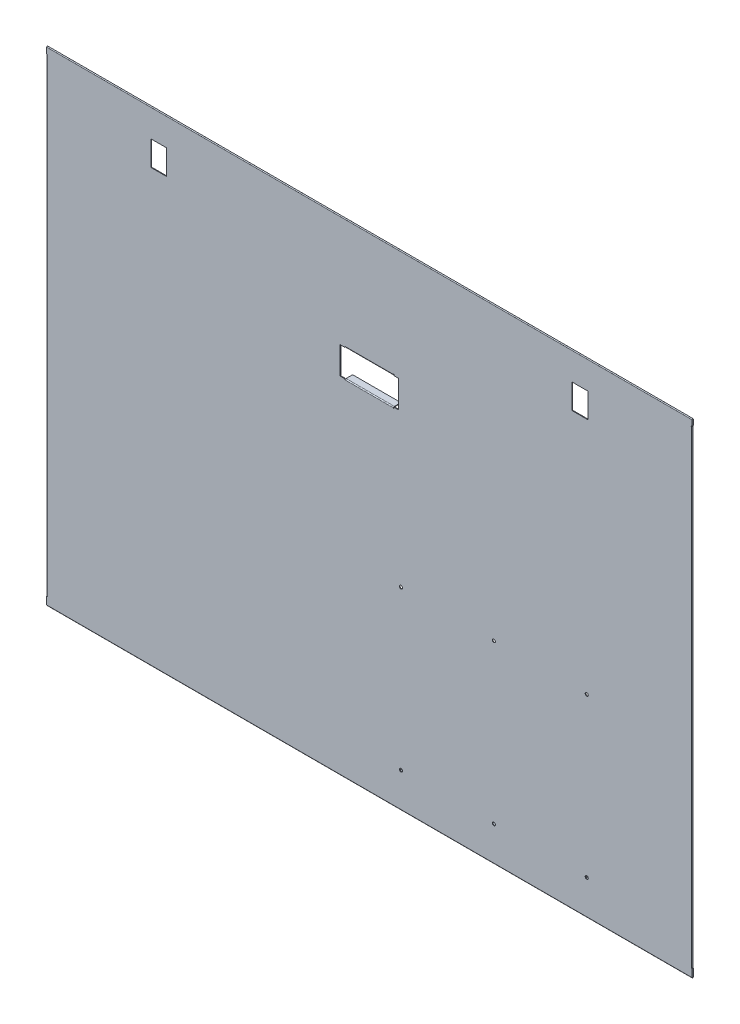
from build123d import *

# Parameters (mm, degrees)
SKETCH_1_W                          = 1042
SKETCH_1_H                          = 782
SM_BASE_FLANGE_1_DEPTH              = 1
SKETCH_3_W                          = 25.5
SKETCH_3_H                          = 40
SKETCH_3_W_2                        = 94
SKETCH_3_H_2                        = 44
CUT_EXTRUDE_1_DEPTH                 = 652.40079828
SM_EDGE_FLANGE_1_STRIP_W            = 5
SM_EDGE_FLANGE_1_STRIP_H            = 1
SM_EDGE_FLANGE_1_STRIP_CUT_DEPTH    = 78
SM_EDGE_FLANGE_1_RELIEF_W           = 5.5
SM_EDGE_FLANGE_1_RELIEF_H           = 0.5
SM_EDGE_FLANGE_1_RELIEF_CUT_DEPTH   = 1
SM_EDGE_FLANGE_1_DEPTH              = 78
SM_EDGE_FLANGE_2_STRIP_W            = 5
SM_EDGE_FLANGE_2_STRIP_H            = 1
SM_EDGE_FLANGE_2_STRIP_CUT_DEPTH    = 78
SM_EDGE_FLANGE_2_RELIEF_W           = 5.5
SM_EDGE_FLANGE_2_RELIEF_H           = 0.5
SM_EDGE_FLANGE_2_RELIEF_CUT_DEPTH   = 1
SM_EDGE_FLANGE_2_DEPTH              = 78
OTHER_START                         = -521
OTHER_1_DEPTH                       = 1042
OTHER_1_2_DEPTH                     = 1042
OTHER_2_DEPTH                       = 1042
OTHER_2_2_DEPTH                     = 1042
SKETCH_12_W                         = 157.957102661
SKETCH_12_H                         = 759
SKETCH_12_W_2                       = 80.930745007
CUT_EXTRUDE_2_DEPTH                 = 1
OTHER_START_2                       = -377.5
OTHER_5_DEPTH                       = 758
OTHER_5_2_DEPTH                     = 0.5
OTHER_START_3                       = 380
OTHER_5_3_DEPTH                     = 0.5
OTHER_START_4                       = -377
OTHER_5_4_DEPTH                     = 757
OTHER_6_DEPTH                       = 758
OTHER_6_2_DEPTH                     = 0.5
OTHER_6_3_DEPTH                     = 0.5
OTHER_6_4_DEPTH                     = 757
SM_EDGE_FLANGE_3_STRIP_W            = 5
SM_EDGE_FLANGE_3_STRIP_H            = 1
SM_EDGE_FLANGE_3_STRIP_CUT_DEPTH    = 902
SM_EDGE_FLANGE_3_RELIEF_W           = 5.5
SM_EDGE_FLANGE_3_RELIEF_H           = 0.5
SM_EDGE_FLANGE_3_RELIEF_CUT_DEPTH   = 1
SM_EDGE_FLANGE_3_DEPTH              = 902
SM_EDGE_FLANGE_3_FLAT_DEPTH         = 1
SM_EDGE_FLANGE_4_STRIP_W            = 5
SM_EDGE_FLANGE_4_STRIP_H            = 1
SM_EDGE_FLANGE_4_STRIP_CUT_DEPTH    = 902
SM_EDGE_FLANGE_4_RELIEF_W           = 5.5
SM_EDGE_FLANGE_4_RELIEF_H           = 0.5
SM_EDGE_FLANGE_4_RELIEF_CUT_DEPTH   = 1
SM_EDGE_FLANGE_4_DEPTH              = 902
SM_EDGE_FLANGE_4_FLAT_DEPTH         = 1
SM_EDGE_FLANGE_5_STRIP_W            = 5
SM_EDGE_FLANGE_5_STRIP_H            = 1
SM_EDGE_FLANGE_5_STRIP_CUT_DEPTH    = 641
SM_EDGE_FLANGE_5_RELIEF_W           = 5.5
SM_EDGE_FLANGE_5_RELIEF_H           = 0.5
SM_EDGE_FLANGE_5_RELIEF_CUT_DEPTH   = 1
SM_EDGE_FLANGE_5_DEPTH              = 641
SM_EDGE_FLANGE_6_STRIP_W            = 5
SM_EDGE_FLANGE_6_STRIP_H            = 1
SM_EDGE_FLANGE_6_STRIP_CUT_DEPTH    = 641
SM_EDGE_FLANGE_6_RELIEF_W           = 5.5
SM_EDGE_FLANGE_6_RELIEF_H           = 0.5
SM_EDGE_FLANGE_6_RELIEF_CUT_DEPTH   = 1
SM_EDGE_FLANGE_6_DEPTH              = 641
SKETCH_64_R                         = 2.5
CUT_EXTRUDE_4_DEPTH                 = 653.291966837
SM_EDGE_FLANGE_7_STRIP_W            = 5
SM_EDGE_FLANGE_7_STRIP_H            = 1
SM_EDGE_FLANGE_7_STRIP_CUT_DEPTH    = 215
SM_EDGE_FLANGE_7_STRIP_2_W          = 5
SM_EDGE_FLANGE_7_STRIP_2_H          = 1
SM_EDGE_FLANGE_7_STRIP_CUT_2_DEPTH  = 287
SM_EDGE_FLANGE_7_RELIEF_W           = 5.5
SM_EDGE_FLANGE_7_RELIEF_H           = 0.5
SM_EDGE_FLANGE_7_RELIEF_CUT_DEPTH   = 1
SM_EDGE_FLANGE_7_STRIP_3_W          = 5
SM_EDGE_FLANGE_7_STRIP_3_H          = 1
SM_EDGE_FLANGE_7_STRIP_CUT_3_DEPTH  = 205
SM_EDGE_FLANGE_7_RELIEF_2_W         = 5.5
SM_EDGE_FLANGE_7_RELIEF_2_H         = 0.5
SM_EDGE_FLANGE_7_RELIEF_CUT_2_DEPTH = 1
SM_EDGE_FLANGE_7_DEPTH              = 215
SM_EDGE_FLANGE_7_BEND_DEPTH         = 287
SM_EDGE_FLANGE_7_BEND_2_DEPTH       = 205
SM_START                            = -451
SM_EDGE_FLANGE_8_DEPTH              = 902
SM_START_2                          = -206
SM_EDGE_FLANGE_8_2_DEPTH            = 287
SM_EDGE_FLANGE_8_3_DEPTH            = 215
SM_START_3                          = 246
SM_EDGE_FLANGE_8_4_DEPTH            = 205


# Read off the part's stored shape, not the designer's step: 褶边1, 褶边2, 褶边5, 褶边6, 边线-法兰8
# Sheet-metal steps are written as plain solids
with BuildPart() as part:
    # Sketch 1 → 基体-法兰1 (new body)
    with BuildSketch(Plane.XY):
        Rectangle(SKETCH_1_W, SKETCH_1_H)
    extrude(amount=-SM_BASE_FLANGE_1_DEPTH)

    # 草图3 → 切除-拉伸1 (cut, through all)
    with BuildSketch(Plane.XY):
        with Locations((-340, 326)):
            Rectangle(SKETCH_3_W, SKETCH_3_H)
        with Locations((340, 326)):
            Rectangle(SKETCH_3_W, SKETCH_3_H)
        with Locations((0, 189)):
            Rectangle(SKETCH_3_W_2, SKETCH_3_H_2)
    extrude(amount=-CUT_EXTRUDE_1_DEPTH, mode=Mode.SUBTRACT)

    # 边线-法兰1 strip (across the edge) → 边线-法兰1 strip cut (cut)
    with BuildSketch(Plane(origin=(39, 211, -1), x_dir=(0, 1, 0), z_dir=(-1, 0, 0))):
        with Locations((-1, -0.5)):
            Rectangle(SM_EDGE_FLANGE_1_STRIP_W, SM_EDGE_FLANGE_1_STRIP_H)
    extrude(amount=SM_EDGE_FLANGE_1_STRIP_CUT_DEPTH, mode=Mode.SUBTRACT)

    # 边线-法兰1 relief (on the sheet) → 边线-法兰1 relief cut (cut)
    with BuildSketch(Plane(origin=(39, 212.5, -1), x_dir=(0, 1, 0), z_dir=(0, 0, -1))):
        with Locations((-2.25, 0.25)):
            Rectangle(SM_EDGE_FLANGE_1_RELIEF_W, SM_EDGE_FLANGE_1_RELIEF_H)
        with Locations((-2.25, -78.25)):
            Rectangle(SM_EDGE_FLANGE_1_RELIEF_W, SM_EDGE_FLANGE_1_RELIEF_H)
    extrude(amount=-SM_EDGE_FLANGE_1_RELIEF_CUT_DEPTH, mode=Mode.SUBTRACT)

    # 边线-法兰1 section (across the edge) → 边线-法兰1 (add)
    with BuildSketch(Plane(origin=(39, 211, -1), x_dir=(0, 1, 0), z_dir=(-1, 0, 0))):
        with BuildLine():
            Line((0, 0.5), (0, 14))
            Line((0, 14), (1, 14))
            Line((1, 14), (1, 0.5))
            ThreePointArc((1, 0.5), (1.146446609, 0.146446609), (1.5, 0))
            Line((1.5, 0), (1.5, -1))
            ThreePointArc((1.5, -1), (0.439339828, -0.560660172), (0, 0.5))
        make_face()
    extrude(amount=SM_EDGE_FLANGE_1_DEPTH)

    # 边线-法兰2 strip (across the edge) → 边线-法兰2 strip cut (cut)
    with BuildSketch(Plane(origin=(-39, 167, -1), x_dir=(0, -1, 0), z_dir=(1, 0, 0))):
        with Locations((-1, -0.5)):
            Rectangle(SM_EDGE_FLANGE_2_STRIP_W, SM_EDGE_FLANGE_2_STRIP_H)
    extrude(amount=SM_EDGE_FLANGE_2_STRIP_CUT_DEPTH, mode=Mode.SUBTRACT)

    # 边线-法兰2 relief (on the sheet) → 边线-法兰2 relief cut (cut)
    with BuildSketch(Plane(origin=(-39, 165.5, -1), x_dir=(0, -1, 0), z_dir=(0, 0, -1))):
        with Locations((-2.25, 0.25)):
            Rectangle(SM_EDGE_FLANGE_2_RELIEF_W, SM_EDGE_FLANGE_2_RELIEF_H)
        with Locations((-2.25, -78.25)):
            Rectangle(SM_EDGE_FLANGE_2_RELIEF_W, SM_EDGE_FLANGE_2_RELIEF_H)
    extrude(amount=-SM_EDGE_FLANGE_2_RELIEF_CUT_DEPTH, mode=Mode.SUBTRACT)

    # 边线-法兰2 section (across the edge) → 边线-法兰2 (add)
    with BuildSketch(Plane(origin=(-39, 167, -1), x_dir=(0, -1, 0), z_dir=(1, 0, 0))):
        with BuildLine():
            Line((0, 0.5), (0, 11))
            Line((0, 11), (1, 11))
            Line((1, 11), (1, 0.5))
            ThreePointArc((1, 0.5), (1.146446609, 0.146446609), (1.5, 0))
            Line((1.5, 0), (1.5, -1))
            ThreePointArc((1.5, -1), (0.439339828, -0.560660172), (0, 0.5))
        make_face()
    extrude(amount=SM_EDGE_FLANGE_2_DEPTH)

    # Other 1 outline → Other 1 (cut)
    with BuildSketch(Plane.YZ.offset(OTHER_START)):
        with BuildLine():
            ThreePointArc((389.95, 0), (390.674568837, -0.290065792), (390.998808848, -1))
            Line((390.998808848, -1), (391, -1))
            Line((391, -1), (391, 0))
            Line((391, 0), (389.95, 0))
        make_face()
    extrude(amount=OTHER_1_DEPTH, mode=Mode.SUBTRACT)

    # Other 1 2 outline → Other 1 2 (add)
    with BuildSketch(Plane.YZ.offset(OTHER_START)):
        with BuildLine():
            Line((369, -1.1), (369, -2.1))
            Line((369, -2.1), (389.95, -2.1))
            ThreePointArc((389.95, -2.1), (390.709934208, -1.774568837), (390.998808848, -1))
            Line((390.998808848, -1), (389.95, -1))
            ThreePointArc((389.95, -1), (390, -1.05), (389.95, -1.1))
            Line((389.95, -1.1), (369, -1.1))
        make_face()
    extrude(amount=OTHER_1_2_DEPTH)

    # Other 2 outline → Other 2 (cut)
    with BuildSketch(Plane.YZ.offset(OTHER_START)):
        with BuildLine():
            Line((-391, -1), (-390.998808848, -1))
            ThreePointArc((-390.998808848, -1), (-390.674568837, -0.290065792), (-389.95, 0))
            Line((-389.95, 0), (-391, 0))
            Line((-391, 0), (-391, -1))
        make_face()
    extrude(amount=OTHER_2_DEPTH, mode=Mode.SUBTRACT)

    # Other 2 2 outline → Other 2 2 (add)
    with BuildSketch(Plane.YZ.offset(OTHER_START)):
        with BuildLine():
            ThreePointArc((-390.998808848, -1), (-390.709934208, -1.774568837), (-389.95, -2.1))
            Line((-389.95, -2.1), (-367, -2.1))
            Line((-367, -2.1), (-367, -1.1))
            Line((-367, -1.1), (-389.95, -1.1))
            ThreePointArc((-389.95, -1.1), (-390, -1.05), (-389.95, -1))
            Line((-389.95, -1), (-390.998808848, -1))
        make_face()
    extrude(amount=OTHER_2_2_DEPTH)

    # 草图12 → 切除-拉伸2 (cut)
    with BuildSketch(Plane(origin=(0, 0, -2.1), x_dir=(-1, 0, 0), z_dir=(0, 0, -1))):
        with Locations((-576.978551331, 1.5)):
            Rectangle(SKETCH_12_W, SKETCH_12_H)
        with Locations((538.465372504, 1.5)):
            Rectangle(SKETCH_12_W_2, SKETCH_12_H)
    extrude(amount=-CUT_EXTRUDE_2_DEPTH, mode=Mode.SUBTRACT)

    # Other 5 outline → Other 5 (cut)
    with BuildSketch(Plane(origin=(0, 0, 0), x_dir=(1, 0, 0), z_dir=(0, 1, 0)).offset(OTHER_START_2)):
        with BuildLine():
            Line((521, 1), (520.998808848, 1))
            ThreePointArc((520.998808848, 1), (520.674568837, 0.290065792), (519.95, 0))
            Line((519.95, 0), (521, 0))
            Line((521, 0), (521, 1))
        make_face()
    extrude(amount=OTHER_5_DEPTH, mode=Mode.SUBTRACT)

    # Other 5 2 outline → Other 5 2 (cut)
    with BuildSketch(Plane(origin=(0, 0, 0), x_dir=(1, 0, 0), z_dir=(0, 1, 0)).offset(OTHER_START_2)):
        with BuildLine():
            ThreePointArc((519.95, 0), (520.674568837, 0.290065792), (520.998808848, 1))
            Line((520.998808848, 1), (519.45, 1))
            Line((519.45, 1), (519.45, 0))
            Line((519.45, 0), (519.95, 0))
        make_face()
    extrude(amount=OTHER_5_2_DEPTH, mode=Mode.SUBTRACT)

    # Other 5 3 outline → Other 5 3 (cut)
    with BuildSketch(Plane(origin=(0, 0, 0), x_dir=(1, 0, 0), z_dir=(0, 1, 0)).offset(OTHER_START_3)):
        with BuildLine():
            ThreePointArc((519.95, 0), (520.674568837, 0.290065792), (520.998808848, 1))
            Line((520.998808848, 1), (519.45, 1))
            Line((519.45, 1), (519.45, 0))
            Line((519.45, 0), (519.95, 0))
        make_face()
    extrude(amount=OTHER_5_3_DEPTH, mode=Mode.SUBTRACT)

    # Other 5 4 outline → Other 5 4 (add)
    with BuildSketch(Plane(origin=(0, 0, 0), x_dir=(1, 0, 0), z_dir=(0, 1, 0)).offset(OTHER_START_4)):
        with BuildLine():
            Line((519.95, 2.1), (499, 2.1))
            Line((499, 2.1), (499, 1.1))
            Line((499, 1.1), (519.95, 1.1))
            ThreePointArc((519.95, 1.1), (520, 1.05), (519.95, 1))
            Line((519.95, 1), (520.998808848, 1))
            ThreePointArc((520.998808848, 1), (520.709934208, 1.774568837), (519.95, 2.1))
        make_face()
    extrude(amount=OTHER_5_4_DEPTH)

    # Other 6 outline → Other 6 (cut)
    with BuildSketch(Plane(origin=(0, 0, 0), x_dir=(1, 0, 0), z_dir=(0, 1, 0)).offset(OTHER_START_2)):
        with BuildLine():
            ThreePointArc((-519.95, 0), (-520.674568837, 0.290065792), (-520.998808848, 1))
            Line((-520.998808848, 1), (-521, 1))
            Line((-521, 1), (-521, 0))
            Line((-521, 0), (-519.95, 0))
        make_face()
    extrude(amount=OTHER_6_DEPTH, mode=Mode.SUBTRACT)

    # Other 6 2 outline → Other 6 2 (cut)
    with BuildSketch(Plane(origin=(0, 0, 0), x_dir=(1, 0, 0), z_dir=(0, 1, 0)).offset(OTHER_START_2)):
        with BuildLine():
            Line((-519.45, 1), (-520.998808848, 1))
            ThreePointArc((-520.998808848, 1), (-520.674568837, 0.290065792), (-519.95, 0))
            Line((-519.95, 0), (-519.45, 0))
            Line((-519.45, 0), (-519.45, 1))
        make_face()
    extrude(amount=OTHER_6_2_DEPTH, mode=Mode.SUBTRACT)

    # Other 6 3 outline → Other 6 3 (cut)
    with BuildSketch(Plane(origin=(0, 0, 0), x_dir=(1, 0, 0), z_dir=(0, 1, 0)).offset(OTHER_START_3)):
        with BuildLine():
            Line((-519.45, 1), (-520.998808848, 1))
            ThreePointArc((-520.998808848, 1), (-520.674568837, 0.290065792), (-519.95, 0))
            Line((-519.95, 0), (-519.45, 0))
            Line((-519.45, 0), (-519.45, 1))
        make_face()
    extrude(amount=OTHER_6_3_DEPTH, mode=Mode.SUBTRACT)

    # Other 6 4 outline → Other 6 4 (add)
    with BuildSketch(Plane(origin=(0, 0, 0), x_dir=(1, 0, 0), z_dir=(0, 1, 0)).offset(OTHER_START_4)):
        with BuildLine():
            Line((-499, 1.1), (-499, 2.1))
            Line((-499, 2.1), (-519.95, 2.1))
            ThreePointArc((-519.95, 2.1), (-520.709934208, 1.774568837), (-520.998808848, 1))
            Line((-520.998808848, 1), (-519.95, 1))
            ThreePointArc((-519.95, 1), (-520, 1.05), (-519.95, 1.1))
            Line((-519.95, 1.1), (-499, 1.1))
        make_face()
    extrude(amount=OTHER_6_4_DEPTH)

    # 边线-法兰3 strip (across the edge) → 边线-法兰3 strip cut (cut)
    with BuildSketch(Plane(origin=(451, 369, -2.1), x_dir=(0, 1, 0), z_dir=(-1, 0, 0))):
        with Locations((-1, -0.5)):
            Rectangle(SM_EDGE_FLANGE_3_STRIP_W, SM_EDGE_FLANGE_3_STRIP_H)
    extrude(amount=SM_EDGE_FLANGE_3_STRIP_CUT_DEPTH, mode=Mode.SUBTRACT)

    # 边线-法兰3 relief (on the sheet) → 边线-法兰3 relief cut (cut)
    with BuildSketch(Plane(origin=(451, 370.5, -2.1), x_dir=(0, 1, 0), z_dir=(0, 0, -1))):
        with Locations((-2.25, 0.25)):
            Rectangle(SM_EDGE_FLANGE_3_RELIEF_W, SM_EDGE_FLANGE_3_RELIEF_H)
        with Locations((-2.25, -902.25)):
            Rectangle(SM_EDGE_FLANGE_3_RELIEF_W, SM_EDGE_FLANGE_3_RELIEF_H)
    extrude(amount=-SM_EDGE_FLANGE_3_RELIEF_CUT_DEPTH, mode=Mode.SUBTRACT)

    # 边线-法兰3 bend section (across the edge) → 边线-法兰3 (add)
    with BuildSketch(Plane(origin=(451, 369, -2.1), x_dir=(0, 1, 0), z_dir=(-1, 0, 0))):
        with BuildLine():
            Line((0, 0.5), (1, 0.5))
            ThreePointArc((1, 0.5), (1.146446609, 0.146446609), (1.5, 0))
            Line((1.5, 0), (1.5, -1))
            ThreePointArc((1.5, -1), (0.439339828, -0.560660172), (0, 0.5))
        make_face()
    extrude(amount=SM_EDGE_FLANGE_3_DEPTH)

    # 边线-法兰3 profile (on flange) → 边线-法兰3 flat (add)
    with BuildSketch(Plane(origin=(0, 369, -2.1), x_dir=(-1, 0, 0), z_dir=(0, -1, 0))):
        Polygon((-451, 0.5), (451, 0.5), (451, 19), (407, 19), (407, 1), (269.5, 1), (269.5, 19), (80, 19), (80, 1), (-80, 1), (-80, 19), (-269.5, 19), (-269.5, 1), (-407, 1), (-407, 19), (-451, 19), align=None)
    extrude(amount=-SM_EDGE_FLANGE_3_FLAT_DEPTH)

    # 边线-法兰4 strip (across the edge) → 边线-法兰4 strip cut (cut)
    with BuildSketch(Plane(origin=(-451, -367, -2.1), x_dir=(0, -1, 0), z_dir=(1, 0, 0))):
        with Locations((-1, -0.5)):
            Rectangle(SM_EDGE_FLANGE_4_STRIP_W, SM_EDGE_FLANGE_4_STRIP_H)
    extrude(amount=SM_EDGE_FLANGE_4_STRIP_CUT_DEPTH, mode=Mode.SUBTRACT)

    # 边线-法兰4 relief (on the sheet) → 边线-法兰4 relief cut (cut)
    with BuildSketch(Plane(origin=(-451, -368.5, -2.1), x_dir=(0, -1, 0), z_dir=(0, 0, -1))):
        with Locations((-2.25, 0.25)):
            Rectangle(SM_EDGE_FLANGE_4_RELIEF_W, SM_EDGE_FLANGE_4_RELIEF_H)
        with Locations((-2.25, -902.25)):
            Rectangle(SM_EDGE_FLANGE_4_RELIEF_W, SM_EDGE_FLANGE_4_RELIEF_H)
    extrude(amount=-SM_EDGE_FLANGE_4_RELIEF_CUT_DEPTH, mode=Mode.SUBTRACT)

    # 边线-法兰4 bend section (across the edge) → 边线-法兰4 (add)
    with BuildSketch(Plane(origin=(-451, -367, -2.1), x_dir=(0, -1, 0), z_dir=(1, 0, 0))):
        with BuildLine():
            Line((0, 0.5), (1, 0.5))
            ThreePointArc((1, 0.5), (1.146446609, 0.146446609), (1.5, 0))
            Line((1.5, 0), (1.5, -1))
            ThreePointArc((1.5, -1), (0.439339828, -0.560660172), (0, 0.5))
        make_face()
    extrude(amount=SM_EDGE_FLANGE_4_DEPTH)

    # 边线-法兰4 profile (on flange) → 边线-法兰4 flat (add)
    with BuildSketch(Plane(origin=(0, -367, -2.1), x_dir=(1, 0, 0), z_dir=(0, 1, 0))):
        Polygon((-451, 0.5), (451, 0.5), (451, 32), (236, 32), (236, 5), (206, 5), (206, 32), (-206, 32), (-206, 7), (-236, 7), (-236, 32), (-451, 32), align=None)
    extrude(amount=-SM_EDGE_FLANGE_4_FLAT_DEPTH)

    # 边线-法兰5 strip (across the edge) → 边线-法兰5 strip cut (cut)
    with BuildSketch(Plane(origin=(499, -319, -2.1), x_dir=(1, 0, 0), z_dir=(0, 1, 0))):
        with Locations((-1, -0.5)):
            Rectangle(SM_EDGE_FLANGE_5_STRIP_W, SM_EDGE_FLANGE_5_STRIP_H)
    extrude(amount=SM_EDGE_FLANGE_5_STRIP_CUT_DEPTH, mode=Mode.SUBTRACT)

    # 边线-法兰5 relief (on the sheet) → 边线-法兰5 relief cut (cut)
    with BuildSketch(Plane(origin=(500.5, -319, -2.1), x_dir=(1, 0, 0), z_dir=(0, 0, -1))):
        with Locations((-2.25, 0.25)):
            Rectangle(SM_EDGE_FLANGE_5_RELIEF_W, SM_EDGE_FLANGE_5_RELIEF_H)
        with Locations((-2.25, -641.25)):
            Rectangle(SM_EDGE_FLANGE_5_RELIEF_W, SM_EDGE_FLANGE_5_RELIEF_H)
    extrude(amount=-SM_EDGE_FLANGE_5_RELIEF_CUT_DEPTH, mode=Mode.SUBTRACT)

    # 边线-法兰5 section (across the edge) → 边线-法兰5 (add)
    with BuildSketch(Plane(origin=(499, -319, -2.1), x_dir=(1, 0, 0), z_dir=(0, 1, 0))):
        with BuildLine():
            Line((0, 0.5), (0, 19))
            Line((0, 19), (1, 19))
            Line((1, 19), (1, 0.5))
            ThreePointArc((1, 0.5), (1.146446609, 0.146446609), (1.5, 0))
            Line((1.5, 0), (1.5, -1))
            ThreePointArc((1.5, -1), (0.439339828, -0.560660172), (0, 0.5))
        make_face()
    extrude(amount=SM_EDGE_FLANGE_5_DEPTH)

    # 边线-法兰6 strip (across the edge) → 边线-法兰6 strip cut (cut)
    with BuildSketch(Plane(origin=(-499, 322, -2.1), x_dir=(-1, 0, 0), z_dir=(0, -1, 0))):
        with Locations((-1, -0.5)):
            Rectangle(SM_EDGE_FLANGE_6_STRIP_W, SM_EDGE_FLANGE_6_STRIP_H)
    extrude(amount=SM_EDGE_FLANGE_6_STRIP_CUT_DEPTH, mode=Mode.SUBTRACT)

    # 边线-法兰6 relief (on the sheet) → 边线-法兰6 relief cut (cut)
    with BuildSketch(Plane(origin=(-500.5, 322, -2.1), x_dir=(-1, 0, 0), z_dir=(0, 0, -1))):
        with Locations((-2.25, 0.25)):
            Rectangle(SM_EDGE_FLANGE_6_RELIEF_W, SM_EDGE_FLANGE_6_RELIEF_H)
        with Locations((-2.25, -641.25)):
            Rectangle(SM_EDGE_FLANGE_6_RELIEF_W, SM_EDGE_FLANGE_6_RELIEF_H)
    extrude(amount=-SM_EDGE_FLANGE_6_RELIEF_CUT_DEPTH, mode=Mode.SUBTRACT)

    # 边线-法兰6 section (across the edge) → 边线-法兰6 (add)
    with BuildSketch(Plane(origin=(-499, 322, -2.1), x_dir=(-1, 0, 0), z_dir=(0, -1, 0))):
        with BuildLine():
            Line((0, 0.5), (0, 19))
            Line((0, 19), (1, 19))
            Line((1, 19), (1, 0.5))
            ThreePointArc((1, 0.5), (1.146446609, 0.146446609), (1.5, 0))
            Line((1.5, 0), (1.5, -1))
            ThreePointArc((1.5, -1), (0.439339828, -0.560660172), (0, 0.5))
        make_face()
    extrude(amount=SM_EDGE_FLANGE_6_DEPTH)

    # 草图64 → 切除-拉伸4 (cut, through all)
    with BuildSketch(Plane.XY):
        with Locations((351, -79)):
            Circle(SKETCH_64_R)
        with Locations((201, -79)):
            Circle(SKETCH_64_R)
        with Locations((51, -79)):
            Circle(SKETCH_64_R)
        with Locations((51, -335)):
            Circle(SKETCH_64_R)
        with Locations((201, -335)):
            Circle(SKETCH_64_R)
        with Locations((351, -335)):
            Circle(SKETCH_64_R)
    extrude(amount=-CUT_EXTRUDE_4_DEPTH, mode=Mode.SUBTRACT)

    # 边线-法兰7 strip (across the edge) → 边线-法兰7 strip cut (cut)
    with BuildSketch(Plane(origin=(-451, -368, -34.1), x_dir=(0, 0, 1), z_dir=(1, 0, 0))):
        with Locations((-1, -0.5)):
            Rectangle(SM_EDGE_FLANGE_7_STRIP_W, SM_EDGE_FLANGE_7_STRIP_H)
    extrude(amount=SM_EDGE_FLANGE_7_STRIP_CUT_DEPTH, mode=Mode.SUBTRACT)

    # 边线-法兰7 strip 2 (across the edge) → 边线-法兰7 strip cut 2 (cut)
    with BuildSketch(Plane(origin=(-206, -368, -34.1), x_dir=(0, 0, 1), z_dir=(1, 0, 0))):
        with Locations((-1, -0.5)):
            Rectangle(SM_EDGE_FLANGE_7_STRIP_2_W, SM_EDGE_FLANGE_7_STRIP_2_H)
    extrude(amount=SM_EDGE_FLANGE_7_STRIP_CUT_2_DEPTH, mode=Mode.SUBTRACT)

    # 边线-法兰7 relief (on the sheet) → 边线-法兰7 relief cut (cut)
    with BuildSketch(Plane(origin=(-206, -368, -32.6), x_dir=(0, 0, 1), z_dir=(0, -1, 0))):
        with Locations((-2.25, -287.25)):
            Rectangle(SM_EDGE_FLANGE_7_RELIEF_W, SM_EDGE_FLANGE_7_RELIEF_H)
    extrude(amount=-SM_EDGE_FLANGE_7_RELIEF_CUT_DEPTH, mode=Mode.SUBTRACT)

    # 边线-法兰7 strip 3 (across the edge) → 边线-法兰7 strip cut 3 (cut)
    with BuildSketch(Plane(origin=(246, -368, -34.1), x_dir=(0, 0, 1), z_dir=(1, 0, 0))):
        with Locations((-1, -0.5)):
            Rectangle(SM_EDGE_FLANGE_7_STRIP_3_W, SM_EDGE_FLANGE_7_STRIP_3_H)
    extrude(amount=SM_EDGE_FLANGE_7_STRIP_CUT_3_DEPTH, mode=Mode.SUBTRACT)

    # 边线-法兰7 relief 2 (on the sheet) → 边线-法兰7 relief cut 2 (cut)
    with BuildSketch(Plane(origin=(246, -368, -32.6), x_dir=(0, 0, 1), z_dir=(0, -1, 0))):
        with Locations((-2.25, 0.25)):
            Rectangle(SM_EDGE_FLANGE_7_RELIEF_2_W, SM_EDGE_FLANGE_7_RELIEF_2_H)
    extrude(amount=-SM_EDGE_FLANGE_7_RELIEF_CUT_2_DEPTH, mode=Mode.SUBTRACT)

    # 边线-法兰7 section (across the edge) → 边线-法兰7 (add)
    with BuildSketch(Plane(origin=(-451, -368, -34.1), x_dir=(0, 0, 1), z_dir=(1, 0, 0))):
        with BuildLine():
            Line((0, 0.5), (0, 9))
            Line((0, 9), (1, 9))
            Line((1, 9), (1, 0.5))
            ThreePointArc((1, 0.5), (1.146446609, 0.146446609), (1.5, 0))
            Line((1.5, 0), (1.5, -1))
            ThreePointArc((1.5, -1), (0.439339828, -0.560660172), (0, 0.5))
        make_face()
    extrude(amount=SM_EDGE_FLANGE_7_DEPTH)

    # 边线-法兰7 section 2 (across the edge) → 边线-法兰7 bend (add)
    with BuildSketch(Plane(origin=(-206, -368, -34.1), x_dir=(0, 0, 1), z_dir=(1, 0, 0))):
        with BuildLine():
            Line((0, 0.5), (0, 9))
            Line((0, 9), (1, 9))
            Line((1, 9), (1, 0.5))
            ThreePointArc((1, 0.5), (1.146446609, 0.146446609), (1.5, 0))
            Line((1.5, 0), (1.5, -1))
            ThreePointArc((1.5, -1), (0.439339828, -0.560660172), (0, 0.5))
        make_face()
    extrude(amount=SM_EDGE_FLANGE_7_BEND_DEPTH)

    # 边线-法兰7 section 3 (across the edge) → 边线-法兰7 bend 2 (add)
    with BuildSketch(Plane(origin=(246, -368, -34.1), x_dir=(0, 0, 1), z_dir=(1, 0, 0))):
        with BuildLine():
            Line((0, 0.5), (0, 9))
            Line((0, 9), (1, 9))
            Line((1, 9), (1, 0.5))
            ThreePointArc((1, 0.5), (1.146446609, 0.146446609), (1.5, 0))
            Line((1.5, 0), (1.5, -1))
            ThreePointArc((1.5, -1), (0.439339828, -0.560660172), (0, 0.5))
        make_face()
    extrude(amount=SM_EDGE_FLANGE_7_BEND_2_DEPTH)

    # 边线-法兰8 outline → 边线-法兰8 (cut)
    with BuildSketch(Plane.YZ.offset(SM_START)):
        with BuildLine():
            Line((-377, -34.1), (-376.439339828, -33.539339828))
            ThreePointArc((-376.439339828, -33.539339828), (-375.952704805, -33.214180701), (-375.378679656, -33.1))
            Line((-375.378679656, -33.1), (-377, -33.1))
            Line((-377, -33.1), (-377, -34.1))
        make_face()
    extrude(amount=SM_EDGE_FLANGE_8_DEPTH, mode=Mode.SUBTRACT)

    # Sm Edge Flange 8 2 outline → Sm Edge Flange 8 2 (add)
    with BuildSketch(Plane.YZ.offset(SM_START_2)):
        with BuildLine():
            Line((-375.378679656, -34.1), (-377, -34.1))
            Line((-377, -34.1), (-379.535533906, -36.635533906))
            Line((-379.535533906, -36.635533906), (-378.828427125, -37.342640687))
            Line((-378.828427125, -37.342640687), (-375.732233047, -34.246446609))
            ThreePointArc((-375.732233047, -34.246446609), (-375.570021372, -34.138060234), (-375.378679656, -34.1))
        make_face()
    extrude(amount=SM_EDGE_FLANGE_8_2_DEPTH)

    # Sm Edge Flange 8 3 outline → Sm Edge Flange 8 3 (add)
    with BuildSketch(Plane.YZ.offset(SM_START)):
        with BuildLine():
            Line((-375.378679656, -34.1), (-377, -34.1))
            Line((-377, -34.1), (-379.535533906, -36.635533906))
            Line((-379.535533906, -36.635533906), (-378.828427125, -37.342640687))
            Line((-378.828427125, -37.342640687), (-375.732233047, -34.246446609))
            ThreePointArc((-375.732233047, -34.246446609), (-375.570021372, -34.138060234), (-375.378679656, -34.1))
        make_face()
    extrude(amount=SM_EDGE_FLANGE_8_3_DEPTH)

    # Sm Edge Flange 8 4 outline → Sm Edge Flange 8 4 (add)
    with BuildSketch(Plane.YZ.offset(SM_START_3)):
        with BuildLine():
            Line((-375.378679656, -34.1), (-377, -34.1))
            Line((-377, -34.1), (-379.535533906, -36.635533906))
            Line((-379.535533906, -36.635533906), (-378.828427125, -37.342640687))
            Line((-378.828427125, -37.342640687), (-375.732233047, -34.246446609))
            ThreePointArc((-375.732233047, -34.246446609), (-375.570021372, -34.138060234), (-375.378679656, -34.1))
        make_face()
    extrude(amount=SM_EDGE_FLANGE_8_4_DEPTH)


solid = part.part
